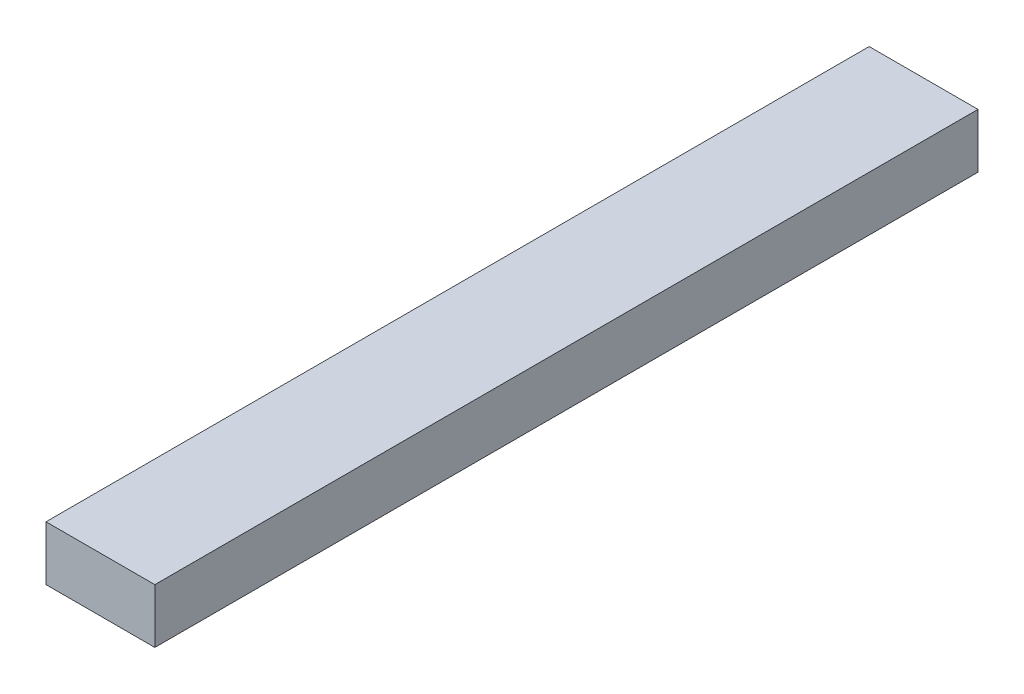
from build123d import *

# Parameters (mm, degrees)
SKETCH1_W           = 50.8
SKETCH1_H           = 25.4
BOSS_EXTRUDE1_DEPTH = 384.175


with BuildPart() as part:
    # Sketch1 → Boss-Extrude1 (new body)
    with BuildSketch(Plane.XY):
        with Locations((25.4, 12.7)):
            Rectangle(SKETCH1_W, SKETCH1_H)
    extrude(amount=BOSS_EXTRUDE1_DEPTH)


solid = part.part
